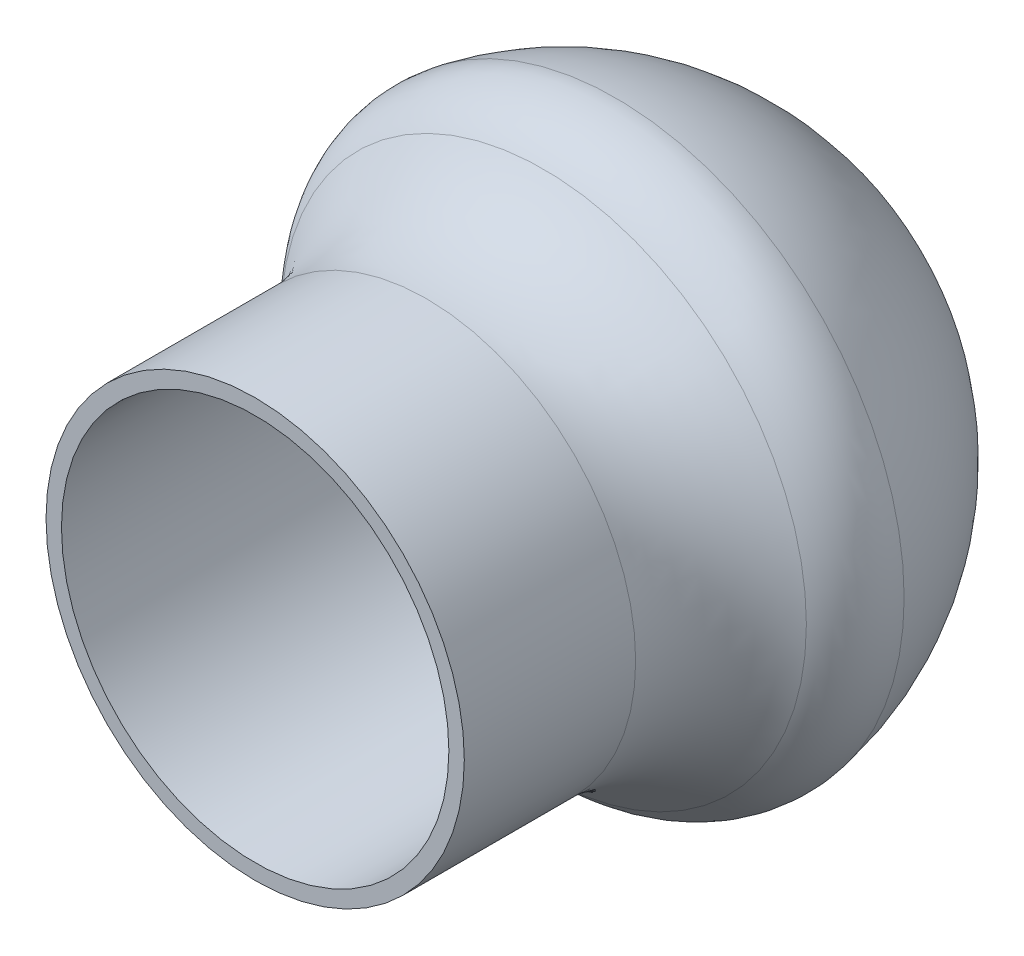
from build123d import *

# Parameters (mm, degrees)
ESQUISSE1_R        = 13.55
ESQUISSE1_R_2      = 12.55
BOSS_EXTRU_1_DEPTH = 20
CONG_1_R           = 10
CONG_2_R           = 5


with BuildPart() as part:
    # Esquisse1 → Boss.-Extru.1 (new body)
    with BuildSketch(Plane.XY):
        Circle(ESQUISSE1_R)
        Circle(ESQUISSE1_R_2, mode=Mode.SUBTRACT)
    extrude(amount=BOSS_EXTRU_1_DEPTH)

    # Esquisse2 → Révolution1 (revolve)
    with BuildSketch(Plane(origin=(0, 0, 0), x_dir=(0, 0, -1), z_dir=(1, 0, 0)), mode=Mode.PRIVATE) as r_volution1_sk:
        with BuildLine():
            Line((18.986494144, 0), (0, 0))
            Line((0, 0), (0, -18.986494144))
            ThreePointArc((0, -18.986494144), (13.42547876, -13.42547876), (18.986494144, 0))
        make_face()
    revolve(r_volution1_sk.sketch.rotate(Axis((0, 0, -18.986494144), (0, 0, 1)), 270), axis=Axis((0, 0, -18.986494144), (0, 0, 1)))

    # Congé1
    # the kernel refuses this fillet: 10 mm, written as the material it adds along each edge
    with BuildSketch(Plane(origin=(0, 0, 0), x_dir=(1, 0, 0), z_dir=(0, -1, 0))) as cong_1_piece_1:
        with BuildLine():
            CenterArc((23.55, 8.898000579), CONG_1_R, 180, 62.848132995)
            Line((13.55, 8.898000579), (13.35, 8.898000579))
            Line((13.35, 8.898000579), (13.35, 0))
            Line((13.35, 0), (13.55, -0.2))
            ThreePointArc((13.55, -0.2), (16.268247072, -0.2), (18.895224027, -0.177960012))
            Line((18.895224027, -0.177960012), (18.986494144, 0))
        make_face()
    revolve(axis=Axis((0, 0, 0), (0, 0, 1)))

    # Congé2
    cong_2_edges = [part.edges().sort_by_distance(p)[0] for p in [
        (0, 18.986494144, 0),
    ]]
    fillet(cong_2_edges, radius=CONG_2_R)


solid = part.part
